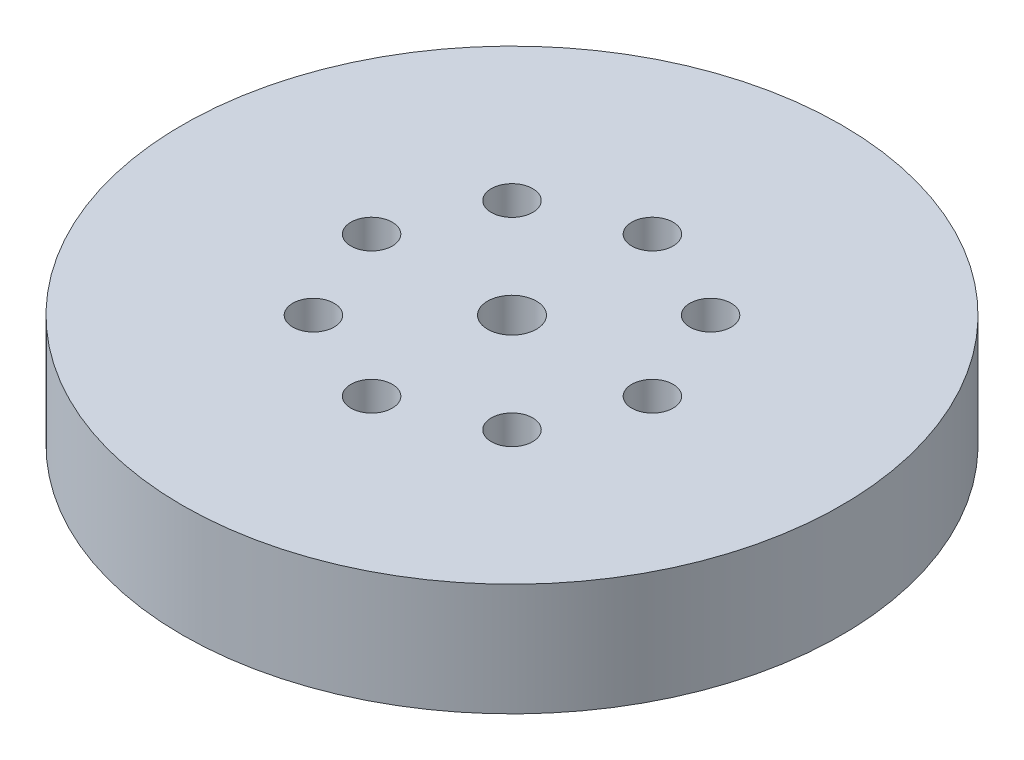
from build123d import *

# Parameters (mm, degrees)
SKETCH1_R           = 67.5
BOSS_EXTRUDE1_DEPTH = 23
SKETCH2_R           = 5
CUT_EXTRUDE1_DEPTH  = 99.19114013
SKETCH3_R           = 4.239120244
CUT_EXTRUDE2_DEPTH  = 21.736494387
CIRPATTERN1_COUNT   = 8


with BuildPart() as part:
    # Sketch1 → Boss-Extrude1 (new body)
    with BuildSketch(Plane(origin=(0, 0, 0), x_dir=(1, 0, 0), z_dir=(0, 1, 0))):
        Circle(SKETCH1_R)
    extrude(amount=BOSS_EXTRUDE1_DEPTH)

    # Sketch2 → Cut-Extrude1 (cut, through all)
    with BuildSketch(Plane(origin=(0, 0, 0), x_dir=(1, 0, 0), z_dir=(0, 1, 0))):
        Circle(SKETCH2_R)
    extrude(amount=CUT_EXTRUDE1_DEPTH, mode=Mode.SUBTRACT)

    # Sketch3 → Cut-Extrude2 (cut)
    with BuildSketch(Plane(origin=(0, 23, 0), x_dir=(1, 0, 0), z_dir=(0, 1, 0))):
        with Locations((-28.757165628, 0)):
            Circle(SKETCH3_R)
    cut_extrude2 = extrude(amount=-CUT_EXTRUDE2_DEPTH, mode=Mode.SUBTRACT)

    # CirPattern1: Cut-Extrude2 ×8 about axis
    cirpattern1_axis = Axis((0, 0, 0), (0, 1, 0))
    for i in range(1, CIRPATTERN1_COUNT):
        add(cut_extrude2.rotate(cirpattern1_axis, i * 360 / CIRPATTERN1_COUNT), mode=Mode.SUBTRACT)


solid = part.part
